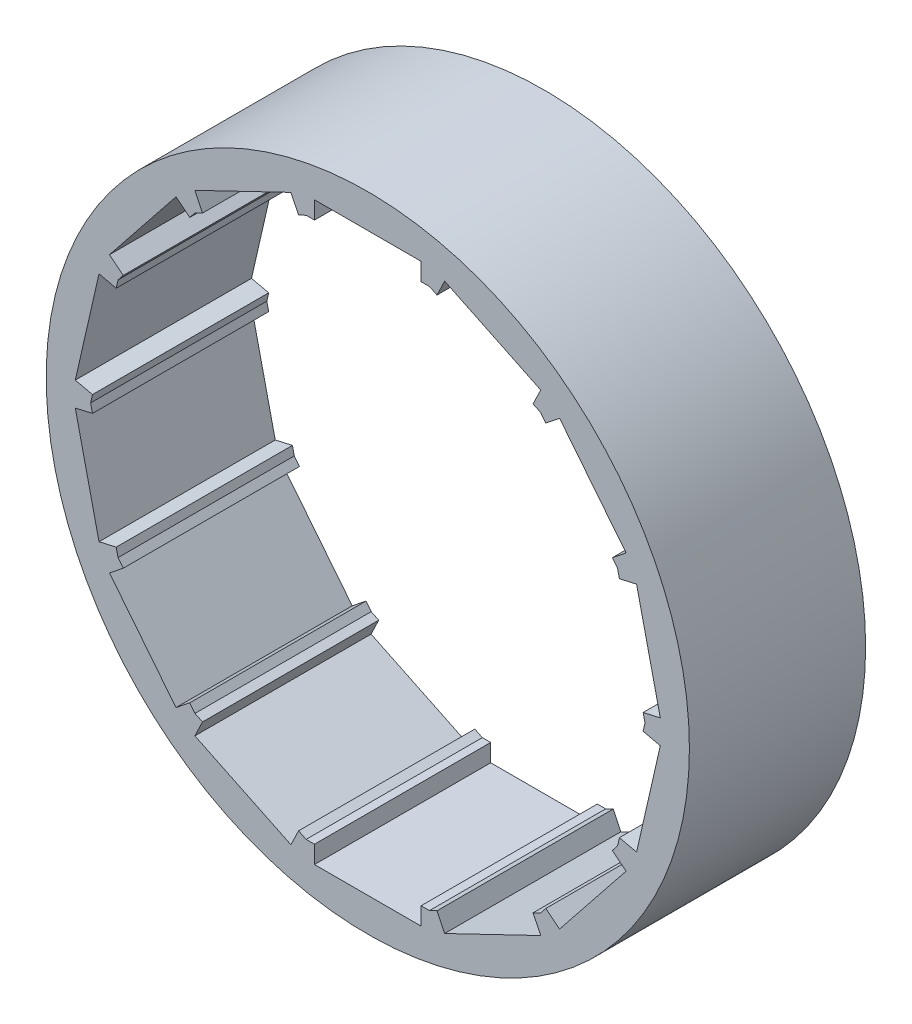
from build123d import *

# Parameters (mm, degrees)
SKETCH_1_R               = 36.5
EXTRUDE_1_DEPTH          = 20
SKETCH_3_W               = 12.1
SKETCH_3_H               = 2
CUT_EXTRUDE_2_DEPTH      = 56.357926262
PATTERN_CIRCULAR_2_COUNT = 14


with BuildPart() as part:
    # ｽｹｯﾁ1 → ﾎﾞｽ - 押し出し1 (new body)
    with BuildSketch(Plane.XY):
        Circle(SKETCH_1_R)
        Polygon((31.457714452, 0), (28.342421377, 13.648990771), (19.613564151, 24.594631525), (7, 30.669003873), (-7, 30.669003873), (-19.613564151, 24.594631525), (-28.342421377, 13.648990771), (-31.457714452, 0), (-28.342421377, -13.648990771), (-19.613564151, -24.594631525), (-7, -30.669003873), (7, -30.669003873), (19.613564151, -24.594631525), (28.342421377, -13.648990771), align=None, mode=Mode.SUBTRACT)
    extrude(amount=EXTRUDE_1_DEPTH)

    # ｽｹｯﾁ3 → ｶｯﾄ - 押し出し2 (cut, through all)
    with BuildSketch(Plane.XY.offset(20)):
        with Locations((0, 31.669003873)):
            Rectangle(SKETCH_3_W, SKETCH_3_H)
    cut_extrude_2 = extrude(amount=-CUT_EXTRUDE_2_DEPTH, mode=Mode.SUBTRACT)

    # 円形ﾊﾟﾀｰﾝ2: ｶｯﾄ - 押し出し2 ×14 about axis
    pattern_circular_2_axis = Axis((0, 0, 0), (0, 0, 1))
    for i in range(1, PATTERN_CIRCULAR_2_COUNT):
        add(cut_extrude_2.rotate(pattern_circular_2_axis, i * 360 / PATTERN_CIRCULAR_2_COUNT), mode=Mode.SUBTRACT)


solid = part.part
